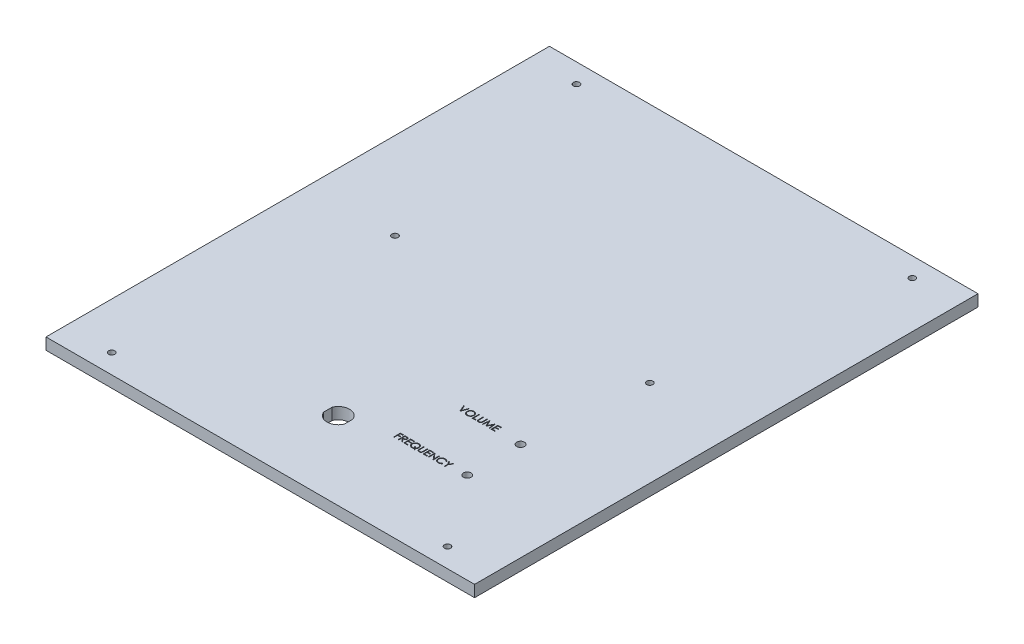
from build123d import *

# Parameters (mm, degrees)
BOSS_EXTRUDE1_DEPTH = 6
SKETCH3_R           = 1.6
SKETCH3_W           = 222
SKETCH3_H           = 30.425305758
CUT_EXTRUDE1_DEPTH  = 10
SKETCH4_R           = 1.6
CUT_EXTRUDE2_DEPTH  = 10
CUT_EXTRUDE3_DEPTH  = 10
SKETCH6_R           = 2
CUT_EXTRUDE4_DEPTH  = 10
CUT_EXTRUDE5_DEPTH  = 1


with BuildPart() as part:
    # Sketch1 → Boss-Extrude1 (new body)
    with BuildSketch(Plane(origin=(0, 0, 0), x_dir=(1, 0, 0), z_dir=(0, 1, 0))):
        Polygon((-111, 125.612652879), (111, 125.612652879), (111, -125.612652879), (111, -165.612652879), (-111, -165.612652879), (-111, -125.612652879), align=None)
    extrude(amount=BOSS_EXTRUDE1_DEPTH)

    # Sketch3 → Cut-Extrude1 (cut)
    with BuildSketch(Plane.XZ):
        with Locations((-66, 29.812652879)):
            Circle(SKETCH3_R)
        with Locations((66, 29.812652879)):
            Circle(SKETCH3_R)
        with Locations((0, -110.4)):
            Rectangle(SKETCH3_W, SKETCH3_H)
    extrude(amount=-CUT_EXTRUDE1_DEPTH, mode=Mode.SUBTRACT)

    # Sketch4 → Cut-Extrude2 (cut)
    with BuildSketch(Plane.XZ):
        with Locations((87, 155.612652879)):
            Circle(SKETCH4_R)
        with Locations((-87, 155.612652879)):
            Circle(SKETCH4_R)
        with Locations((-87, -85.187347121)):
            Circle(SKETCH4_R)
        with Locations((87, -85.187347121)):
            Circle(SKETCH4_R)
    extrude(amount=-CUT_EXTRUDE2_DEPTH, mode=Mode.SUBTRACT)

    # Sketch5 → Cut-Extrude3 (cut)
    with BuildSketch(Plane(origin=(0, 0, 0), x_dir=(-1, 0, 0), z_dir=(0, -1, 0))):
        with BuildLine():
            Line((-5.375, -123.020074488), (-5.375, -127.40523127))
            ThreePointArc((-5.375, -127.40523127), (0, -131.017652879), (5.375, -127.40523127))
            Line((5.375, -127.40523127), (5.375, -123.020074488))
            ThreePointArc((5.375, -123.020074488), (0, -119.407652879), (-5.375, -123.020074488))
        make_face()
    extrude(amount=-CUT_EXTRUDE3_DEPTH, mode=Mode.SUBTRACT)

    # Sketch6 → Cut-Extrude4 (cut)
    with BuildSketch(Plane.XZ):
        with Locations((60.087916792, 90.868161769)):
            Circle(SKETCH6_R)
        with Locations((60.087916792, 118.481397227)):
            Circle(SKETCH6_R)
    extrude(amount=-CUT_EXTRUDE4_DEPTH, mode=Mode.SUBTRACT)

    # Sketch10 → Cut-Extrude5 (cut)
    # profile 1 of 15: a face of its own
    with BuildSketch(Plane(origin=(0, 6, 0), x_dir=(1, 0, 0), z_dir=(0, 1, 0))):
        Polygon((27.998808243, -88.209916027), (28.335346705, -88.209916027), (29.502013372, -90.968129168), (30.668680038, -88.209916027), (31.0052185, -88.209916027), (29.524449269, -91.709916027), (29.479577474, -91.709916027), align=None)
    # profile 2 of 15: a face of its own
    with BuildSketch(Plane(origin=(0, 6, 0), x_dir=(1, 0, 0), z_dir=(0, 1, 0))):
        with BuildLine():
            add(Edge.make_bspline(
                [(33.271244141, -88.120172438), (33.336052247, -88.121813917), (33.463340714, -88.125037918), (33.650415611, -88.149717021), (33.829010707, -88.192412411), (34.000580846, -88.249275394), (34.163073822, -88.325129779), (34.317712715, -88.416814928), (34.464129588, -88.525291386), (34.60035097, -88.649720613), (34.72500792, -88.785104067), (34.834833807, -88.929581977), (34.9268761, -89.08228078), (35.002461887, -89.24274161), (35.061760497, -89.410601578), (35.102679541, -89.586755581), (35.128817691, -89.770062271), (35.131873468, -89.895089136), (35.133423628, -89.958513784)],
                knots=[0, 0, 0, 0, 1.065120563, 2.091984664, 3.0946048, 4.079830382, 5.057816894, 6.036188127, 7.030412546, 8.04752943, 9.064399622, 10.05169764, 11.02544977, 11.989514704, 12.962713494, 13.945757189, 14.957906945, 16, 16, 16, 16], degree=3))
            add(Edge.make_bspline(
                [(35.133423628, -89.958513784), (35.131873696, -90.02147123), (35.128818599, -90.145567651), (35.102649821, -90.327711095), (35.061608821, -90.502801791), (35.003012555, -90.670547444), (34.927787077, -90.831125008), (34.835131906, -90.984111962), (34.725990695, -91.12955846), (34.601783844, -91.265871125), (34.466382802, -91.390868596), (34.321152535, -91.499787472), (34.169359215, -91.593511596), (34.009049507, -91.66829527), (33.84234947, -91.728067191), (33.667767147, -91.768819821), (33.486120593, -91.795106864), (33.362249589, -91.79812538), (33.299289013, -91.799659617)],
                knots=[0, 0, 0, 0, 1.043624062, 2.057103931, 3.04512605, 4.022047818, 4.998200453, 5.980619268, 6.982898556, 8.009068085, 9.034988726, 10.034168286, 11.015286542, 11.987931943, 12.962482838, 13.94673481, 14.956375938, 16, 16, 16, 16], degree=3))
            add(Edge.make_bspline(
                [(33.299289013, -91.799659617), (33.235864694, -91.79811023), (33.110838478, -91.795055976), (32.927301442, -91.768874572), (32.751023699, -91.727933268), (32.582509347, -91.669423831), (32.421664418, -91.593806601), (32.268174335, -91.501602222), (32.122655188, -91.392195081), (31.986313441, -91.268028506), (31.861564243, -91.132856954), (31.752804867, -90.988022699), (31.660579754, -90.836367242), (31.585216422, -90.677469718), (31.525551962, -90.512098275), (31.484847144, -90.339149798), (31.458511192, -90.159610292), (31.455476346, -90.037367394), (31.453936449, -89.975340707)],
                knots=[0, 0, 0, 0, 1.053102029, 2.075944431, 3.073151272, 4.055350789, 5.033113405, 6.020478099, 7.024410459, 8.052272461, 9.079885166, 10.07527673, 11.055994387, 12.023226415, 12.992069828, 13.970394897, 14.97016774, 16, 16, 16, 16], degree=3))
            add(Edge.make_bspline(
                [(31.453936449, -89.975340707), (31.454471084, -89.933708038), (31.45553361, -89.850967914), (31.468325303, -89.728101314), (31.486887004, -89.607210656), (31.513488917, -89.488639708), (31.548280584, -89.372678724), (31.589332611, -89.258527961), (31.639472456, -89.147344237), (31.696153104, -89.038600845), (31.759414912, -88.933992939), (31.829290662, -88.835113356), (31.90332603, -88.74113236), (31.984489424, -88.654485356), (32.070105869, -88.572651699), (32.161564247, -88.496888982), (32.258306492, -88.426514031), (32.360748871, -88.36309369), (32.466367146, -88.305734556), (32.575243924, -88.256512705), (32.685900496, -88.214266643), (32.798855144, -88.180025818), (32.913807916, -88.152993782), (33.0310097, -88.134586428), (33.150367126, -88.12176211), (33.230778445, -88.120704608), (33.271244141, -88.120172438)],
                knots=[0, 0, 0, 0, 1.037015668, 2.060948919, 3.074880161, 4.083647147, 5.086022904, 6.090072063, 7.104153813, 8.122640571, 9.144368836, 10.147691507, 11.138137339, 12.123020368, 13.103399296, 14.087645067, 15.080126199, 16.082011238, 17.087798457, 18.072939717, 19.057185487, 20.037253025, 21.01195951, 21.997135196, 22.992090687, 24, 24, 24, 24], degree=3))
        make_face()
        with BuildLine():
            add(Edge.make_bspline(
                [(33.28666882, -88.479146797), (33.253454187, -88.479551687), (33.187342454, -88.480357597), (33.089057918, -88.490973312), (32.992065984, -88.506103201), (32.896346622, -88.527684722), (32.802300332, -88.557088775), (32.709050491, -88.590929683), (32.617447437, -88.632150773), (32.527793579, -88.678723478), (32.440878504, -88.730272399), (32.358865803, -88.787244166), (32.281543159, -88.84830272), (32.209099892, -88.913590557), (32.14174872, -88.983440159), (32.078164019, -89.056792595), (32.020894437, -89.135744486), (31.96840886, -89.218154893), (31.92144102, -89.303916474), (31.879675665, -89.392126337), (31.845511656, -89.483504023), (31.81764928, -89.577058181), (31.794549469, -89.672640641), (31.779915545, -89.770976489), (31.769183186, -89.871571601), (31.76842334, -89.939553455), (31.768039013, -89.973938463)],
                knots=[0, 0, 0, 0, 1.008559885, 2.007477868, 2.99961109, 3.989939068, 4.984837346, 5.991145699, 7.001802488, 8.033829008, 9.059044045, 10.069351652, 11.065060232, 12.050310815, 13.029377138, 14.011219647, 14.996725999, 15.989392538, 16.977580475, 17.965360261, 18.951710183, 19.937753436, 20.929683414, 21.935841486, 22.955955122, 24, 24, 24, 24], degree=3))
            add(Edge.make_bspline(
                [(31.768039013, -89.973938463), (31.769313875, -90.024500684), (31.771821922, -90.123972214), (31.793779493, -90.269740358), (31.827601467, -90.409828645), (31.877458833, -90.543470554), (31.939809448, -90.671814837), (32.016836338, -90.793722941), (32.108095424, -90.909227816), (32.211758951, -91.017523085), (32.325081657, -91.116368889), (32.445414387, -91.203132298), (32.571467995, -91.276542547), (32.703571197, -91.33634762), (32.841018736, -91.383737358), (32.984696287, -91.416215989), (33.133646747, -91.437591444), (33.235177402, -91.4396442), (33.28666882, -91.440685258)],
                knots=[0, 0, 0, 0, 1.032063989, 2.030389145, 3.003944642, 3.970395727, 4.937377036, 5.913328081, 6.909231446, 7.93887556, 8.970685674, 9.976071282, 10.964166581, 11.944589148, 12.933237628, 13.927779006, 14.949070134, 16, 16, 16, 16], degree=3))
            add(Edge.make_bspline(
                [(33.28666882, -91.440685258), (33.321278322, -91.440209754), (33.389919358, -91.439266686), (33.492014881, -91.429768009), (33.592271092, -91.41453614), (33.690547372, -91.392605484), (33.786732184, -91.365158277), (33.881226987, -91.33255055), (33.973025277, -91.291869346), (34.063285115, -91.246921394), (34.149681357, -91.195681237), (34.232156889, -91.140643087), (34.308632869, -91.079674466), (34.38102194, -91.015356654), (34.448649629, -90.946392806), (34.511058613, -90.872872584), (34.568038746, -90.794331927), (34.620504392, -90.712046521), (34.667307655, -90.626050268), (34.708086754, -90.537520591), (34.74268287, -90.446675481), (34.770611375, -90.35338391), (34.792496836, -90.257823061), (34.807576756, -90.159864983), (34.818125195, -90.05970564), (34.818920272, -89.991961784), (34.819321064, -89.957812662)],
                knots=[0, 0, 0, 0, 1.047197238, 2.076906641, 3.100256066, 4.114471768, 5.12198147, 6.126382909, 7.136867548, 8.15857795, 9.17633901, 10.174870724, 11.156907918, 12.133735059, 13.104061851, 14.077631395, 15.04955518, 16.038496417, 17.029181396, 18.010275684, 18.986308667, 19.968651475, 20.955262928, 21.950658345, 22.966943676, 24, 24, 24, 24], degree=3))
            add(Edge.make_bspline(
                [(34.819321064, -89.957812662), (34.818919951, -89.923897158), (34.818124269, -89.856619508), (34.807581795, -89.757158689), (34.792480905, -89.659905478), (34.770718196, -89.565241675), (34.742668043, -89.47314315), (34.708080712, -89.383696402), (34.667295413, -89.296568207), (34.620487188, -89.21197391), (34.567871365, -89.130799172), (34.510377122, -89.053196759), (34.447011774, -88.980624018), (34.379585749, -88.911289324), (34.306414863, -88.846671434), (34.227830569, -88.786748914), (34.144786892, -88.730075639), (34.056859656, -88.678950078), (33.966115702, -88.631735845), (33.873001744, -88.591284842), (33.778572645, -88.556912722), (33.683068532, -88.527595757), (33.585685554, -88.506187727), (33.487081725, -88.490959677), (33.387393467, -88.480361291), (33.320350247, -88.479552913), (33.28666882, -88.479146797)],
                knots=[0, 0, 0, 0, 1.02996197, 2.043119294, 3.035359645, 4.018872909, 4.991431989, 5.957985074, 6.929999688, 7.912076566, 8.892894881, 9.867085534, 10.843653904, 11.817741046, 12.803660682, 13.806313499, 14.818574707, 15.856120519, 16.894564902, 17.924820532, 18.937903209, 19.946497019, 20.957711757, 21.963978472, 22.977135795, 24, 24, 24, 24], degree=3))
        make_face(mode=Mode.SUBTRACT)
    # profile 3 of 15: a face of its own
    with BuildSketch(Plane(origin=(0, 6, 0), x_dir=(1, 0, 0), z_dir=(0, 1, 0))):
        Polygon((35.851372346, -88.209916027), (36.16547491, -88.209916027), (36.16547491, -91.350941668), (37.511628756, -91.350941668), (37.511628756, -91.709916027), (35.851372346, -91.709916027), align=None)
    # profile 4 of 15: a face of its own
    with BuildSketch(Plane(origin=(0, 6, 0), x_dir=(1, 0, 0), z_dir=(0, 1, 0))):
        with BuildLine():
            Line((38.09496209, -88.209916027), (38.409064654, -88.209916027))
            Line((38.409064654, -88.209916027), (38.409064654, -90.306971316))
            add(Edge.make_bspline(
                [(38.409064654, -90.306971316), (38.40901791, -90.336652052), (38.408929205, -90.392976363), (38.409521719, -90.473144663), (38.411181087, -90.544417122), (38.412227247, -90.60706847), (38.41455458, -90.660811217), (38.416452627, -90.705936528), (38.418893184, -90.74223073), (38.421826301, -90.763411656), (38.42308709, -90.772516188)],
                knots=[0, 0, 0, 0, 1.528628734, 2.90083645, 4.128790002, 5.200304208, 6.127813768, 6.898992206, 7.526736466, 8, 8, 8, 8], degree=3))
            add(Edge.make_bspline(
                [(38.42308709, -90.772516188), (38.428264548, -90.805362951), (38.438327735, -90.86920568), (38.463974113, -90.960113962), (38.499791614, -91.04204542), (38.542234656, -91.117556711), (38.598167268, -91.184546071), (38.665170803, -91.246257724), (38.746348571, -91.300229529), (38.836609177, -91.349580341), (38.933894415, -91.389245423), (39.033305681, -91.419238787), (39.13334866, -91.437517687), (39.200324825, -91.439634226), (39.233583884, -91.440685258)],
                knots=[0, 0, 0, 0, 1.035780045, 2.013197591, 2.933192213, 3.817615948, 4.702609284, 5.640816605, 6.646850145, 7.73207398, 8.84249596, 9.914020372, 10.964143139, 12, 12, 12, 12], degree=3))
            add(Edge.make_bspline(
                [(39.233583884, -91.440685258), (39.262137625, -91.439611408), (39.319080187, -91.43746991), (39.403686617, -91.424208479), (39.486086726, -91.400307913), (39.566687406, -91.369468154), (39.64223839, -91.328720563), (39.712781832, -91.281649724), (39.775745767, -91.226438848), (39.833203764, -91.165338503), (39.8832387, -91.096398703), (39.926609842, -91.021120565), (39.962135772, -90.938371218), (39.979679296, -90.880216796), (39.988692058, -90.850340707)],
                knots=[0, 0, 0, 0, 0.994687771, 1.983630487, 2.973142513, 3.978332533, 4.983357753, 5.956394766, 6.925816176, 7.893390482, 8.871859704, 9.88551698, 10.913711441, 12, 12, 12, 12], degree=3))
            add(Edge.make_bspline(
                [(39.988692058, -90.850340707), (39.991692183, -90.837992132), (39.998377671, -90.810474532), (40.004624716, -90.763953242), (40.011131241, -90.709063878), (40.015645811, -90.645412065), (40.020047032, -90.573211092), (40.022680105, -90.492084835), (40.023897138, -90.402327874), (40.024259818, -90.339690712), (40.024449269, -90.306971316)],
                knots=[0, 0, 0, 0, 0.558680831, 1.244966039, 2.062412453, 2.990489873, 4.051219941, 5.244515665, 6.560634259, 8, 8, 8, 8], degree=3))
            Line((40.024449269, -90.306971316), (40.024449269, -88.209916027))
            Line((40.024449269, -88.209916027), (40.338551833, -88.209916027))
            Line((40.338551833, -88.209916027), (40.338551833, -90.323798239))
            add(Edge.make_bspline(
                [(40.338551833, -90.323798239), (40.338297713, -90.361896618), (40.337801781, -90.436247921), (40.333501205, -90.54519928), (40.326644205, -90.648552261), (40.316956117, -90.746320758), (40.304119114, -90.838154917), (40.289843893, -90.924859685), (40.27166436, -91.005812678), (40.250430959, -91.081645095), (40.226157411, -91.153830609), (40.194716263, -91.222339223), (40.159291763, -91.289253623), (40.11727711, -91.353561732), (40.070065727, -91.415548285), (40.016614047, -91.47483736), (39.958689886, -91.532376406), (39.895330326, -91.586689472), (39.827579801, -91.636498149), (39.755639843, -91.68029592), (39.680063073, -91.717319538), (39.601045947, -91.747795462), (39.518554744, -91.770710062), (39.432587385, -91.787785217), (39.342948191, -91.797487515), (39.281983535, -91.798929445), (39.251111929, -91.799659617)],
                knots=[0, 0, 0, 0, 1.316592851, 2.569410997, 3.76748051, 4.895814652, 5.963796859, 6.97159953, 7.931736103, 8.829262218, 9.692595152, 10.560224239, 11.431080259, 12.30701507, 13.211635791, 14.121146779, 15.063487852, 16.031507147, 17.00238618, 17.966455255, 18.938106653, 19.907068911, 20.888905087, 21.893141452, 22.933117798, 24, 24, 24, 24], degree=3))
            add(Edge.make_bspline(
                [(39.251111929, -91.799659617), (39.217442827, -91.798874852), (39.151384168, -91.797335145), (39.054046101, -91.788512395), (38.960731904, -91.771894001), (38.870456027, -91.750734057), (38.78444753, -91.72155032), (38.701554086, -91.687452195), (38.623195405, -91.645574935), (38.548100276, -91.598981542), (38.47827552, -91.546556903), (38.414178117, -91.489416729), (38.355702246, -91.428476352), (38.30383355, -91.363075986), (38.257712665, -91.293724279), (38.217982452, -91.220225039), (38.183869208, -91.142606723), (38.166262641, -91.088653523), (38.157361929, -91.061378367)],
                knots=[0, 0, 0, 0, 1.13879206, 2.234305948, 3.301075583, 4.341971843, 5.366689343, 6.369221514, 7.369726634, 8.367512178, 9.355451585, 10.318319045, 11.268648973, 12.207971039, 13.137398894, 14.081662264, 15.030215811, 16, 16, 16, 16], degree=3))
            add(Edge.make_bspline(
                [(38.157361929, -91.061378367), (38.152184771, -91.042745793), (38.1409554, -91.002331324), (38.128930102, -90.935444835), (38.118821021, -90.858429918), (38.109315462, -90.771281299), (38.103706504, -90.673931433), (38.098789066, -90.566422517), (38.094927447, -90.448624555), (38.094950219, -90.366570039), (38.09496209, -90.323798239)],
                knots=[0, 0, 0, 0, 0.625038921, 1.35572334, 2.194682327, 3.136881307, 4.189498639, 5.346923369, 6.617055217, 8, 8, 8, 8], degree=3))
            Line((38.09496209, -90.323798239), (38.09496209, -88.209916027))
        make_face()
    # profile 5 of 15: a face of its own
    with BuildSketch(Plane(origin=(0, 6, 0), x_dir=(1, 0, 0), z_dir=(0, 1, 0))):
        Polygon((41.056500551, -91.709916027), (41.518539814, -88.209916027), (41.563411609, -88.209916027), (43.008423628, -91.081710899), (44.449930038, -88.209916027), (44.495502955, -88.209916027), (44.960346705, -91.709916027), (44.644841897, -91.709916027), (44.309705679, -89.19148654), (43.046284205, -91.709916027), (42.975470904, -91.709916027), (41.707141577, -89.185877566), (41.372706481, -91.709916027), align=None)
    # profile 6 of 15: a face of its own
    with BuildSketch(Plane(origin=(0, 6, 0), x_dir=(1, 0, 0), z_dir=(0, 1, 0))):
        Polygon((45.678295423, -88.209916027), (47.652654397, -88.209916027), (47.652654397, -88.568890386), (45.992397987, -88.568890386), (45.992397987, -89.645813463), (47.652654397, -89.645813463), (47.652654397, -90.004787822), (45.992397987, -90.004787822), (45.992397987, -91.350941668), (47.652654397, -91.350941668), (47.652654397, -91.709916027), (45.678295423, -91.709916027), align=None)
    # profile 7 of 15: a face of its own
    with BuildSketch(Plane(origin=(0, 6, 0), x_dir=(1, 0, 0), z_dir=(0, 1, 0))):
        Polygon((23.92527127, -116.96042876), (25.630399476, -116.96042876), (25.630399476, -117.319403119), (24.239373834, -117.319403119), (24.239373834, -118.396326196), (25.630399476, -118.396326196), (25.630399476, -118.755300555), (24.239373834, -118.755300555), (24.239373834, -120.46042876), (23.92527127, -120.46042876), align=None)
    # profile 8 of 15: a face of its own
    with BuildSketch(Plane(origin=(0, 6, 0), x_dir=(1, 0, 0), z_dir=(0, 1, 0))):
        with BuildLine():
            Line((26.258604604, -116.96042876), (26.959025277, -116.96042876))
            add(Edge.make_bspline(
                [(26.959025277, -116.96042876), (27.005766405, -116.960584346), (27.09551455, -116.960883089), (27.22408782, -116.962548852), (27.340914917, -116.967323207), (27.445934756, -116.971431791), (27.539145411, -116.978923732), (27.620832702, -116.986084379), (27.6906204, -116.99545804), (27.732866251, -117.004163463), (27.751994027, -117.008105043)],
                knots=[0, 0, 0, 0, 1.410062039, 2.707475311, 3.878576406, 4.937260626, 5.877586885, 6.699081471, 7.410979367, 8, 8, 8, 8], degree=3))
            add(Edge.make_bspline(
                [(27.751994027, -117.008105043), (27.777600651, -117.014431808), (27.82826764, -117.026950372), (27.901217706, -117.053409972), (27.97073203, -117.084029597), (28.036521855, -117.119993317), (28.098257646, -117.161568097), (28.156575957, -117.208036219), (28.21174142, -117.259143425), (28.26152305, -117.316178267), (28.308462102, -117.376014776), (28.348050728, -117.440718533), (28.382177208, -117.508380061), (28.409347725, -117.579687478), (28.431225699, -117.65394925), (28.446651938, -117.731838047), (28.455903126, -117.812999022), (28.456844981, -117.868356931), (28.457322552, -117.896426357)],
                knots=[0, 0, 0, 0, 1.027469482, 2.033020251, 3.019912614, 3.986113645, 4.951240523, 5.91722682, 6.890402269, 7.87763091, 8.8651537, 9.85103654, 10.82876324, 11.815024772, 12.821070561, 13.842952187, 14.906261191, 16, 16, 16, 16], degree=3))
            add(Edge.make_bspline(
                [(28.457322552, -117.896426357), (28.455853554, -117.943061461), (28.452987159, -118.034058629), (28.426262055, -118.166119511), (28.382485535, -118.289308825), (28.322162246, -118.403471463), (28.24534277, -118.506382108), (28.153017979, -118.596772564), (28.045136368, -118.672412476), (27.944707052, -118.724865281), (27.855992852, -118.75845819), (27.782959539, -118.782094549), (27.703292562, -118.800356514), (27.617755227, -118.816716646), (27.525991572, -118.82906834), (27.428221532, -118.838114934), (27.324375381, -118.843768983), (27.253036311, -118.844610988), (27.216336976, -118.845044145)],
                knots=[0, 0, 0, 0, 1.260483769, 2.459530307, 3.627416485, 4.787058657, 5.939039949, 7.08810263, 8.267026773, 9.491475466, 10.141966685, 10.831826277, 11.566392101, 12.351337768, 13.187381173, 14.07005841, 15.007169909, 16, 16, 16, 16], degree=3))
            Line((27.216336976, -118.845044145), (28.502194347, -120.46042876))
            Line((28.502194347, -120.46042876), (28.113772873, -120.46042876))
            Line((28.113772873, -120.46042876), (26.827915501, -118.845044145))
            Line((26.827915501, -118.845044145), (26.572707168, -118.845044145))
            Line((26.572707168, -118.845044145), (26.572707168, -120.46042876))
            Line((26.572707168, -120.46042876), (26.258604604, -120.46042876))
            Line((26.258604604, -120.46042876), (26.258604604, -116.96042876))
        make_face()
        with BuildLine():
            Line((26.572707168, -117.319403119), (26.572707168, -118.486069786))
            Line((26.572707168, -118.486069786), (27.213532488, -118.490977639))
            add(Edge.make_bspline(
                [(27.213532488, -118.490977639), (27.243452527, -118.490990875), (27.301446084, -118.491016532), (27.385346749, -118.487022755), (27.463466861, -118.482479437), (27.535507613, -118.475530092), (27.601501188, -118.46657402), (27.661414602, -118.455371036), (27.715345653, -118.442318973), (27.778244192, -118.422117347), (27.848480723, -118.390111329), (27.924812183, -118.34354583), (27.989814521, -118.284976711), (28.044732383, -118.218003255), (28.088861815, -118.144367006), (28.119973869, -118.064950637), (28.139716311, -117.981759039), (28.142044857, -117.924580931), (28.143219988, -117.895725235)],
                knots=[0, 0, 0, 0, 1.146690395, 2.22261258, 3.21895312, 4.145990853, 4.996080663, 5.770904154, 6.481378293, 7.121626537, 8.300444488, 9.431385265, 10.535395872, 11.636531494, 12.74115979, 13.810798291, 14.895190096, 16, 16, 16, 16], degree=3))
            add(Edge.make_bspline(
                [(28.143219988, -117.895725235), (28.142017867, -117.867578661), (28.139635702, -117.811802422), (28.120186933, -117.730146512), (28.087297552, -117.653079562), (28.042975314, -117.580915077), (27.988976159, -117.515409341), (27.925658346, -117.459362188), (27.854753151, -117.413112723), (27.788481953, -117.383558343), (27.72924774, -117.36543849), (27.67781808, -117.352687326), (27.619706603, -117.342442857), (27.554631144, -117.334234796), (27.482869513, -117.327179852), (27.404058862, -117.322428073), (27.318722082, -117.319614209), (27.259575151, -117.31947512), (27.228957168, -117.319403119)],
                knots=[0, 0, 0, 0, 1.101028733, 2.181837193, 3.264309656, 4.369019818, 5.486613113, 6.575447106, 7.666700264, 8.788928104, 9.402425223, 10.0903467, 10.862060571, 11.710948788, 12.657782767, 13.684531032, 14.801375019, 16, 16, 16, 16], degree=3))
            Line((27.228957168, -117.319403119), (26.572707168, -117.319403119))
        make_face(mode=Mode.SUBTRACT)
    # profile 9 of 15: a face of its own
    with BuildSketch(Plane(origin=(0, 6, 0), x_dir=(1, 0, 0), z_dir=(0, 1, 0))):
        Polygon((29.220143065, -116.96042876), (31.19450204, -116.96042876), (31.19450204, -117.319403119), (29.534245629, -117.319403119), (29.534245629, -118.396326196), (31.19450204, -118.396326196), (31.19450204, -118.755300555), (29.534245629, -118.755300555), (29.534245629, -120.101454401), (31.19450204, -120.101454401), (31.19450204, -120.46042876), (29.220143065, -120.46042876), align=None)
    # profile 10 of 15: a face of its own
    with BuildSketch(Plane(origin=(0, 6, 0), x_dir=(1, 0, 0), z_dir=(0, 1, 0))):
        with BuildLine():
            Line((34.740074956, -120.070605043), (35.277835373, -120.72965953))
            Line((35.277835373, -120.72965953), (34.88590829, -120.72965953))
            Line((34.88590829, -120.72965953), (34.497486815, -120.254298953))
            add(Edge.make_bspline(
                [(34.497486815, -120.254298953), (34.458529722, -120.277972688), (34.381333158, -120.32488407), (34.26096652, -120.385350237), (34.13820622, -120.435665975), (34.013323877, -120.477235949), (33.886501389, -120.510510274), (33.757095651, -120.533604064), (33.625576007, -120.547014339), (33.537213605, -120.549115667), (33.492779283, -120.55017235)],
                knots=[0, 0, 0, 0, 1.030216282, 2.041455142, 3.041201647, 4.026904037, 5.014869161, 6.002481075, 6.995518502, 8, 8, 8, 8], degree=3))
            add(Edge.make_bspline(
                [(33.492779283, -120.55017235), (33.429118942, -120.548639004), (33.303854342, -120.545621835), (33.119884225, -120.519281378), (32.943300606, -120.478600859), (32.774455455, -120.419740194), (32.613164843, -120.344557711), (32.459503705, -120.251868436), (32.31339394, -120.142956221), (32.17699235, -120.018532841), (32.052266932, -119.883177535), (31.942828194, -119.738556497), (31.849775697, -119.587069537), (31.774537211, -119.427961239), (31.714825417, -119.262616752), (31.674133448, -119.089660957), (31.64779401, -118.910123436), (31.644759642, -118.787880265), (31.643219988, -118.72585344)],
                knots=[0, 0, 0, 0, 1.055750571, 2.07740284, 3.077223765, 4.05828044, 5.038417088, 6.02463293, 7.030503776, 8.057169806, 9.083586829, 10.080154041, 11.061747002, 12.027853603, 12.995569715, 13.972756451, 14.971366004, 16, 16, 16, 16], degree=3))
            add(Edge.make_bspline(
                [(31.643219988, -118.72585344), (31.643767781, -118.684222156), (31.644859517, -118.601252084), (31.657488669, -118.478364912), (31.676252459, -118.357500782), (31.702793113, -118.239161954), (31.737537041, -118.122863377), (31.779191425, -118.008834372), (31.829661255, -117.897368763), (31.886716174, -117.788694686), (31.950348773, -117.683754026), (32.019665209, -117.584040367), (32.094836005, -117.490536394), (32.175807946, -117.403284888), (32.262257655, -117.322092979), (32.353441734, -117.245623681), (32.451304411, -117.176721731), (32.553262786, -117.112645682), (32.65988863, -117.05629967), (32.769096345, -117.005928135), (32.881702863, -116.965057982), (32.996247105, -116.930231661), (33.113423999, -116.903643751), (33.233142222, -116.885017512), (33.355317551, -116.872266546), (33.437825192, -116.871215514), (33.479457969, -116.870685171)],
                knots=[0, 0, 0, 0, 1.030721839, 2.054201982, 3.056261636, 4.058906239, 5.055198403, 6.060579377, 7.06322398, 8.083343201, 9.098870418, 10.10084648, 11.0888991, 12.067804703, 13.046436456, 14.024708667, 15.012489976, 16.008294399, 17.005242112, 17.997338632, 18.984424362, 19.969624474, 20.960977749, 21.957320355, 22.969278161, 24, 24, 24, 24], degree=3))
            add(Edge.make_bspline(
                [(33.479457969, -116.870685171), (33.543118548, -116.872210819), (33.668151998, -116.87520729), (33.851666361, -116.901551719), (34.027729772, -116.942395481), (34.196216897, -117.000956177), (34.356977514, -117.076327996), (34.509944086, -117.168998589), (34.655353769, -117.277918019), (34.791042617, -117.40234973), (34.915474282, -117.538038572), (35.024393884, -117.683448236), (35.117063852, -117.836414889), (35.192437984, -117.997175201), (35.250989976, -118.165663476), (35.291919402, -118.3419483), (35.318138042, -118.525715218), (35.321167551, -118.650976723), (35.322707168, -118.714635491)],
                knots=[0, 0, 0, 0, 1.050672203, 2.063587442, 3.054842799, 4.031180399, 5.003107577, 5.981273811, 6.979214548, 7.998088659, 9.016962771, 10.014903508, 10.993069742, 11.96499692, 12.941334519, 13.932589877, 14.949327797, 16, 16, 16, 16], degree=3))
            add(Edge.make_bspline(
                [(35.322707168, -118.714635491), (35.32102455, -118.780872857), (35.317715777, -118.911124888), (35.289557549, -119.102125613), (35.244284062, -119.2845763), (35.18008079, -119.458357405), (35.097080468, -119.623437342), (34.996886602, -119.781466927), (34.878292847, -119.932434955), (34.786632791, -120.024063309), (34.740074956, -120.070605043)],
                knots=[0, 0, 0, 0, 1.045660934, 2.056233022, 3.041853582, 4.009978652, 4.97562384, 5.954545411, 6.961031197, 8, 8, 8, 8], degree=3))
        make_face()
        with BuildLine():
            add(Edge.make_bspline(
                [(34.529037296, -119.8118911), (34.567225977, -119.773108127), (34.642344805, -119.696820299), (34.739810008, -119.571712299), (34.82363986, -119.441665066), (34.890754783, -119.304948666), (34.944153855, -119.163275954), (34.981046748, -119.015524369), (35.00414683, -118.862366547), (35.007107754, -118.758187192), (35.008604604, -118.705520908)],
                knots=[0, 0, 0, 0, 1.052210109, 2.069743939, 3.061837814, 4.040478349, 5.010453814, 5.985306305, 6.981502329, 8, 8, 8, 8], degree=3))
            add(Edge.make_bspline(
                [(35.008604604, -118.705520908), (35.008213499, -118.671604475), (35.007440354, -118.604557665), (34.99680963, -118.505340148), (34.981770317, -118.408313978), (34.959998001, -118.313652516), (34.931960608, -118.22154755), (34.897331965, -118.132124112), (34.856786756, -118.045093717), (34.809519902, -117.960996993), (34.757412194, -117.879955828), (34.699409923, -117.802961318), (34.636329503, -117.730410468), (34.568860059, -117.661107673), (34.495700781, -117.59648152), (34.417114046, -117.536559711), (34.334068221, -117.479892155), (34.246152359, -117.428742371), (34.155555089, -117.381718127), (34.062806531, -117.340998041), (33.968685467, -117.306509588), (33.873337646, -117.278543881), (33.776886451, -117.256531308), (33.679162782, -117.241508823), (33.580419354, -117.230889046), (33.514074884, -117.230069718), (33.480860213, -117.22965953)],
                knots=[0, 0, 0, 0, 1.032958288, 2.041976502, 3.037103433, 4.023477888, 4.998866292, 5.968231228, 6.943073582, 7.921783703, 8.90545537, 9.876780072, 10.85618943, 11.833110341, 12.821898168, 13.827467856, 14.842673888, 15.88323808, 16.924703457, 17.951432745, 18.967462636, 19.976958182, 20.977218729, 21.979378626, 22.98839684, 24, 24, 24, 24], degree=3))
            add(Edge.make_bspline(
                [(33.480860213, -117.22965953), (33.447412451, -117.23007258), (33.380602843, -117.23089762), (33.281382698, -117.241450087), (33.183434753, -117.256547846), (33.087189803, -117.278451013), (32.992307012, -117.306471106), (32.899080887, -117.341168061), (32.806700686, -117.380882378), (32.717083384, -117.427876597), (32.630385779, -117.479466219), (32.547930871, -117.535570314), (32.470848645, -117.596748634), (32.398407904, -117.662016213), (32.330789578, -117.731876641), (32.267674409, -117.805865208), (32.210170809, -117.884840408), (32.157486695, -117.967389249), (32.110921975, -118.053601422), (32.068926506, -118.141921452), (32.034816857, -118.233323055), (32.006813559, -118.327074657), (31.983930625, -118.422943183), (31.969181686, -118.521485146), (31.95847122, -118.622085388), (31.95770839, -118.690066542), (31.957322552, -118.724451196)],
                knots=[0, 0, 0, 0, 1.013205451, 2.023808328, 3.020541854, 4.015386314, 5.012622987, 6.016502547, 7.02834558, 8.057881235, 9.080621846, 10.084476421, 11.077781791, 12.060654405, 13.037357686, 14.022218736, 15.005346502, 15.995617173, 16.98763393, 17.973029642, 18.956998942, 19.940662314, 20.93709383, 21.940823471, 22.958474994, 24, 24, 24, 24], degree=3))
            add(Edge.make_bspline(
                [(31.957322552, -118.724451196), (31.958636109, -118.775004108), (31.961220281, -118.874457323), (31.982642425, -119.020471809), (32.018559337, -119.160258299), (32.068808589, -119.294016775), (32.131889632, -119.422518197), (32.210335679, -119.54450368), (32.303812057, -119.659508598), (32.408782514, -119.768322877), (32.524251583, -119.866904257), (32.646659996, -119.953666635), (32.774962659, -120.027276825), (32.909562462, -120.086688837), (33.049455692, -120.134398693), (33.195746661, -120.166699219), (33.34747906, -120.188108876), (33.450870468, -120.190158639), (33.50329611, -120.191197991)],
                knots=[0, 0, 0, 0, 1.022526523, 2.011626, 2.97850031, 3.937665323, 4.897797383, 5.869804095, 6.865337375, 7.89202157, 8.925035373, 9.93268082, 10.923937058, 11.912550332, 12.905497077, 13.90928476, 14.939882052, 16, 16, 16, 16], degree=3))
            add(Edge.make_bspline(
                [(33.50329611, -120.191197991), (33.539314514, -120.19080562), (33.610556373, -120.190029539), (33.715610379, -120.17944892), (33.818093604, -120.164556482), (33.917057029, -120.141906541), (34.013358821, -120.113747684), (34.106425761, -120.079494976), (34.196751534, -120.038888102), (34.254184603, -120.006763286), (34.282943546, -119.990677158)],
                knots=[0, 0, 0, 0, 1.060694673, 2.097979151, 3.107774411, 4.11000626, 5.086069662, 6.061987343, 7.029562652, 8, 8, 8, 8], degree=3))
            Line((34.282943546, -119.990677158), (33.494882649, -119.024531325))
            Line((33.494882649, -119.024531325), (33.886809732, -119.024531325))
            Line((33.886809732, -119.024531325), (34.529037296, -119.8118911))
        make_face(mode=Mode.SUBTRACT)
    # profile 11 of 15: a face of its own
    with BuildSketch(Plane(origin=(0, 6, 0), x_dir=(1, 0, 0), z_dir=(0, 1, 0))):
        with BuildLine():
            Line((36.040655886, -116.96042876), (36.35475845, -116.96042876))
            Line((36.35475845, -116.96042876), (36.35475845, -119.057484049))
            add(Edge.make_bspline(
                [(36.35475845, -119.057484049), (36.354711706, -119.087164785), (36.354623001, -119.143489096), (36.355215515, -119.223657396), (36.356874883, -119.294929855), (36.357921043, -119.357581203), (36.360248377, -119.41132395), (36.362146423, -119.456449261), (36.36458698, -119.492743463), (36.367520098, -119.513924389), (36.368780886, -119.523028921)],
                knots=[0, 0, 0, 0, 1.528628734, 2.90083645, 4.128790002, 5.200304208, 6.127813768, 6.898992206, 7.526736466, 8, 8, 8, 8], degree=3))
            add(Edge.make_bspline(
                [(36.368780886, -119.523028921), (36.373958345, -119.555875684), (36.384021531, -119.619718413), (36.409667909, -119.710626695), (36.44548541, -119.792558153), (36.487928452, -119.868069444), (36.543861064, -119.935058804), (36.610864599, -119.996770457), (36.692042368, -120.050742262), (36.782302973, -120.100093074), (36.879588211, -120.139758156), (36.978999477, -120.16975152), (37.079042456, -120.18803042), (37.146018621, -120.190146959), (37.179277681, -120.191197991)],
                knots=[0, 0, 0, 0, 1.035780045, 2.013197591, 2.933192213, 3.817615948, 4.702609284, 5.640816605, 6.646850145, 7.73207398, 8.84249596, 9.914020372, 10.964143139, 12, 12, 12, 12], degree=3))
            add(Edge.make_bspline(
                [(37.179277681, -120.191197991), (37.207831421, -120.190124141), (37.264773983, -120.187982643), (37.349380414, -120.174721212), (37.431780522, -120.150820646), (37.512381202, -120.119980888), (37.587932187, -120.079233296), (37.658475629, -120.032162457), (37.721439563, -119.976951581), (37.778897561, -119.915851236), (37.828932497, -119.846911436), (37.872303638, -119.771633298), (37.907829568, -119.688883952), (37.925373093, -119.630729529), (37.934385854, -119.60085344)],
                knots=[0, 0, 0, 0, 0.994687771, 1.983630487, 2.973142513, 3.978332533, 4.983357753, 5.956394766, 6.925816176, 7.893390482, 8.871859704, 9.88551698, 10.913711441, 12, 12, 12, 12], degree=3))
            add(Edge.make_bspline(
                [(37.934385854, -119.60085344), (37.937385979, -119.588504866), (37.944071467, -119.560987266), (37.950318512, -119.514465975), (37.956825038, -119.459576611), (37.961339608, -119.395924798), (37.965740828, -119.323723826), (37.968373901, -119.242597568), (37.969590934, -119.152840607), (37.969953614, -119.090203446), (37.970143065, -119.057484049)],
                knots=[0, 0, 0, 0, 0.558680831, 1.244966039, 2.062412453, 2.990489873, 4.051219941, 5.244515665, 6.560634259, 8, 8, 8, 8], degree=3))
            Line((37.970143065, -119.057484049), (37.970143065, -116.96042876))
            Line((37.970143065, -116.96042876), (38.284245629, -116.96042876))
            Line((38.284245629, -116.96042876), (38.284245629, -119.074310972))
            add(Edge.make_bspline(
                [(38.284245629, -119.074310972), (38.283991509, -119.112409351), (38.283495578, -119.186760654), (38.279195001, -119.295712013), (38.272338001, -119.399064994), (38.262649913, -119.496833491), (38.24981291, -119.58866765), (38.23553769, -119.675372418), (38.217358157, -119.756325411), (38.196124755, -119.832157828), (38.171851207, -119.904343342), (38.140410059, -119.972851956), (38.104985559, -120.039766356), (38.062970906, -120.104074465), (38.015759523, -120.166061018), (37.962307843, -120.225350093), (37.904383682, -120.282889139), (37.841024122, -120.337202206), (37.773273597, -120.387010882), (37.701333639, -120.430808654), (37.62575687, -120.467832271), (37.546739743, -120.498308195), (37.464248541, -120.521222795), (37.378281181, -120.53829795), (37.288641988, -120.548000248), (37.227677331, -120.549442178), (37.196805726, -120.55017235)],
                knots=[0, 0, 0, 0, 1.316592851, 2.569410997, 3.76748051, 4.895814652, 5.963796859, 6.97159953, 7.931736103, 8.829262218, 9.692595152, 10.560224239, 11.431080259, 12.30701507, 13.211635791, 14.121146779, 15.063487852, 16.031507147, 17.00238618, 17.966455255, 18.938106653, 19.907068911, 20.888905087, 21.893141452, 22.933117798, 24, 24, 24, 24], degree=3))
            add(Edge.make_bspline(
                [(37.196805726, -120.55017235), (37.163136623, -120.549387585), (37.097077964, -120.547847878), (36.999739897, -120.539025128), (36.9064257, -120.522406734), (36.816149823, -120.50124679), (36.730141326, -120.472063053), (36.647247882, -120.437964928), (36.568889201, -120.396087668), (36.493794072, -120.349494275), (36.423969316, -120.297069637), (36.359871913, -120.239929463), (36.301396042, -120.178989085), (36.249527346, -120.113588719), (36.203406461, -120.044237012), (36.163676248, -119.970737773), (36.129563004, -119.893119456), (36.111956437, -119.839166256), (36.103055726, -119.8118911)],
                knots=[0, 0, 0, 0, 1.13879206, 2.234305948, 3.301075583, 4.341971843, 5.366689343, 6.369221514, 7.369726634, 8.367512178, 9.355451585, 10.318319045, 11.268648973, 12.207971039, 13.137398894, 14.081662264, 15.030215811, 16, 16, 16, 16], degree=3))
            add(Edge.make_bspline(
                [(36.103055726, -119.8118911), (36.097878567, -119.793258526), (36.086649196, -119.752844057), (36.074623898, -119.685957568), (36.064514817, -119.608942651), (36.055009258, -119.521794032), (36.0494003, -119.424444166), (36.044482862, -119.31693525), (36.040621243, -119.199137288), (36.040644015, -119.117082772), (36.040655886, -119.074310972)],
                knots=[0, 0, 0, 0, 0.625038921, 1.35572334, 2.194682327, 3.136881307, 4.189498639, 5.346923369, 6.617055217, 8, 8, 8, 8], degree=3))
            Line((36.040655886, -119.074310972), (36.040655886, -116.96042876))
        make_face()
    # profile 12 of 15: a face of its own
    with BuildSketch(Plane(origin=(0, 6, 0), x_dir=(1, 0, 0), z_dir=(0, 1, 0))):
        Polygon((39.181681527, -116.96042876), (41.156040501, -116.96042876), (41.156040501, -117.319403119), (39.495784091, -117.319403119), (39.495784091, -118.396326196), (41.156040501, -118.396326196), (41.156040501, -118.755300555), (39.495784091, -118.755300555), (39.495784091, -120.101454401), (41.156040501, -120.101454401), (41.156040501, -120.46042876), (39.181681527, -120.46042876), align=None)
    # profile 13 of 15: a face of its own
    with BuildSketch(Plane(origin=(0, 6, 0), x_dir=(1, 0, 0), z_dir=(0, 1, 0))):
        Polygon((41.784245629, -120.46042876), (41.784245629, -116.96042876), (41.850151078, -116.96042876), (44.162450758, -119.715136293), (44.162450758, -116.96042876), (44.476553322, -116.96042876), (44.476553322, -120.46042876), (44.405038899, -120.46042876), (42.098348193, -117.712031325), (42.098348193, -120.46042876), align=None)
    # profile 14 of 15: a face of its own
    with BuildSketch(Plane(origin=(0, 6, 0), x_dir=(1, 0, 0), z_dir=(0, 1, 0))):
        with BuildLine():
            Line((48.60475845, -117.602656325), (48.329918706, -117.812992863))
            add(Edge.make_bspline(
                [(48.329918706, -117.812992863), (48.310312818, -117.789626893), (48.271365371, -117.743209977), (48.208706169, -117.678030433), (48.143404526, -117.616965172), (48.075485404, -117.559723292), (48.003726285, -117.508306526), (47.929865486, -117.460035423), (47.852667441, -117.416767685), (47.745915706, -117.364304699), (47.606267858, -117.309558544), (47.430473019, -117.263655313), (47.246961921, -117.234434137), (47.121764321, -117.231269296), (47.05808377, -117.22965953)],
                knots=[0, 0, 0, 0, 0.757959112, 1.505699292, 2.245454638, 2.979532153, 3.711538275, 4.438200793, 5.171680507, 5.909471876, 7.393775596, 8.890124382, 10.418191784, 12, 12, 12, 12], degree=3))
            add(Edge.make_bspline(
                [(47.05808377, -117.22965953), (47.023000471, -117.230063492), (46.953159478, -117.230867668), (46.849511005, -117.241476793), (46.747797954, -117.256388003), (46.648086488, -117.278513327), (46.550503529, -117.306485946), (46.454411127, -117.33991136), (46.361200527, -117.381266199), (46.269582289, -117.426974459), (46.181803078, -117.478601904), (46.09874803, -117.534915256), (46.020720062, -117.595284352), (45.94765745, -117.659935459), (45.879485502, -117.728577419), (45.816698191, -117.801941761), (45.759512781, -117.879793934), (45.706795756, -117.961107342), (45.659583022, -118.045645134), (45.620053143, -118.133720204), (45.585048021, -118.223824307), (45.557348778, -118.316975468), (45.535424261, -118.412518234), (45.520296598, -118.510709022), (45.509808127, -118.611342701), (45.50900795, -118.679552014), (45.508604604, -118.713934369)],
                knots=[0, 0, 0, 0, 1.054917814, 2.100044995, 3.131103042, 4.146048494, 5.169673617, 6.183595914, 7.203665975, 8.234915748, 9.262203917, 10.264457458, 11.251630812, 12.227803204, 13.197192746, 14.159520551, 15.12972552, 16.100847026, 17.073214652, 18.039054194, 19.002613845, 19.979014051, 20.95965708, 21.949030935, 22.966165397, 24, 24, 24, 24], degree=3))
            add(Edge.make_bspline(
                [(45.508604604, -118.713934369), (45.509866423, -118.765665689), (45.512343837, -118.867233274), (45.534392171, -119.016003885), (45.567897262, -119.158524559), (45.618112839, -119.293904401), (45.68003189, -119.423812759), (45.758272501, -119.546051612), (45.848889039, -119.662468177), (45.953163458, -119.770311125), (46.067569274, -119.86882485), (46.190317186, -119.955575431), (46.321101474, -120.027890314), (46.458478104, -120.08806626), (46.603504218, -120.134322988), (46.75591902, -120.166887112), (46.915391015, -120.188129292), (47.024360415, -120.19016298), (47.079818546, -120.191197991)],
                knots=[0, 0, 0, 0, 1.029171465, 2.020641659, 2.987623507, 3.938342917, 4.889210282, 5.84687017, 6.821220943, 7.821438502, 8.827599549, 9.822697543, 10.807740252, 11.797342354, 12.80366471, 13.83203677, 14.896651826, 16, 16, 16, 16], degree=3))
            add(Edge.make_bspline(
                [(47.079818546, -120.191197991), (47.140921235, -120.189509211), (47.261185944, -120.186185289), (47.43755397, -120.15802604), (47.606389736, -120.112368122), (47.767702322, -120.0484702), (47.921036969, -119.965404912), (48.066633629, -119.864707034), (48.204615199, -119.745418702), (48.287586482, -119.654335573), (48.329918706, -119.607864658)],
                knots=[0, 0, 0, 0, 1.028121516, 2.023589091, 2.998037872, 3.967518031, 4.937445131, 5.927275754, 6.942489185, 8, 8, 8, 8], degree=3))
            Line((48.329918706, -119.607864658), (48.60475845, -119.816097831))
            add(Edge.make_bspline(
                [(48.60475845, -119.816097831), (48.58264034, -119.844636283), (48.538510065, -119.901576489), (48.467052048, -119.981848199), (48.39177475, -120.057352234), (48.31211904, -120.127479856), (48.229001249, -120.193634321), (48.140928936, -120.253936152), (48.049059904, -120.309227037), (47.953705425, -120.359853961), (47.854966812, -120.404771208), (47.752962377, -120.443224976), (47.648131802, -120.476349866), (47.540470293, -120.503601802), (47.429754537, -120.524872886), (47.316384062, -120.539092561), (47.200114187, -120.548834476), (47.121672766, -120.549722391), (47.081921911, -120.55017235)],
                knots=[0, 0, 0, 0, 0.986787822, 1.968848986, 2.935600012, 3.899624008, 4.868462664, 5.837806735, 6.815139263, 7.798259679, 8.787526145, 9.778297419, 10.776456485, 11.791383307, 12.812564526, 13.85620153, 14.913611965, 16, 16, 16, 16], degree=3))
            add(Edge.make_bspline(
                [(47.081921911, -120.55017235), (47.044278244, -120.549910358), (46.969842554, -120.5493923), (46.859943803, -120.541000132), (46.752954222, -120.529550395), (46.649179596, -120.512310264), (46.548053621, -120.491965924), (46.450493036, -120.464694668), (46.355537826, -120.434145501), (46.263569485, -120.398240514), (46.174509786, -120.357724332), (46.088645974, -120.311932773), (46.006017542, -120.261250908), (45.925812121, -120.206795898), (45.849214537, -120.146818596), (45.775561012, -120.082151961), (45.704438536, -120.013013951), (45.660435851, -119.963159097), (45.638312136, -119.938093023)],
                knots=[0, 0, 0, 0, 1.114604814, 2.203992996, 3.262667896, 4.300477797, 5.318619304, 6.316056647, 7.298880507, 8.271930387, 9.238335007, 10.195173496, 11.151986948, 12.108099108, 13.064862484, 14.031167946, 15.010108607, 16, 16, 16, 16], degree=3))
            add(Edge.make_bspline(
                [(45.638312136, -119.938093023), (45.602876492, -119.894551834), (45.532433015, -119.807995124), (45.442307332, -119.667709143), (45.365159777, -119.521240934), (45.302783856, -119.367821005), (45.254021123, -119.207793618), (45.220239928, -119.041078103), (45.198288323, -118.867830161), (45.195778034, -118.749993373), (45.19450204, -118.690096228)],
                knots=[0, 0, 0, 0, 0.994628077, 1.977248131, 2.950237994, 3.925870899, 4.908910175, 5.911660606, 6.938484602, 8, 8, 8, 8], degree=3))
            add(Edge.make_bspline(
                [(45.19450204, -118.690096228), (45.196057233, -118.627140775), (45.199116979, -118.50327985), (45.225112775, -118.321505897), (45.266931571, -118.147354498), (45.32632846, -117.981150754), (45.401633811, -117.822020473), (45.494660425, -117.671179268), (45.604327567, -117.527662469), (45.729775135, -117.393647718), (45.86734247, -117.271108365), (46.014661284, -117.163302161), (46.171443231, -117.073584645), (46.335961083, -116.998588483), (46.509446764, -116.94094402), (46.691530133, -116.900590833), (46.881869048, -116.875473717), (47.011731474, -116.872298509), (47.077715181, -116.870685171)],
                knots=[0, 0, 0, 0, 1.032925535, 2.032216505, 3.007276963, 3.968222605, 4.92396291, 5.891752235, 6.871517503, 7.883894988, 8.900124299, 9.891468569, 10.874487609, 11.85992873, 12.854644235, 13.869047385, 14.917252991, 16, 16, 16, 16], degree=3))
            add(Edge.make_bspline(
                [(47.077715181, -116.870685171), (47.117929653, -116.871167309), (47.19753015, -116.872121653), (47.315282802, -116.881427795), (47.429925129, -116.896941401), (47.541536111, -116.918057471), (47.650658727, -116.944264793), (47.756458968, -116.978405091), (47.859557655, -117.017441622), (47.959304563, -117.062400088), (48.055221114, -117.112866829), (48.147277432, -117.168282453), (48.234742291, -117.228578259), (48.318231139, -117.293241434), (48.39634735, -117.363639993), (48.471308829, -117.437837589), (48.540569907, -117.517971413), (48.583323102, -117.574376347), (48.60475845, -117.602656325)],
                knots=[0, 0, 0, 0, 1.096760587, 2.17092713, 3.219439832, 4.250915756, 5.268269357, 6.278326846, 7.281116186, 8.274029601, 9.260640565, 10.235837813, 11.203064059, 12.156899882, 13.114053108, 14.069676657, 15.032185724, 16, 16, 16, 16], degree=3))
        make_face()
    # profile 15 of 15: a face of its own
    with BuildSketch(Plane(origin=(0, 6, 0), x_dir=(1, 0, 0), z_dir=(0, 1, 0))):
        Polygon((49.053476399, -116.96042876), (49.413151879, -116.96042876), (50.333023674, -118.46433501), (51.251493226, -116.96042876), (51.611168706, -116.96042876), (50.489373834, -118.796666741), (50.489373834, -120.46042876), (50.17527127, -120.46042876), (50.17527127, -118.796666741), align=None)
    extrude(amount=-CUT_EXTRUDE5_DEPTH, mode=Mode.SUBTRACT)


solid = part.part
